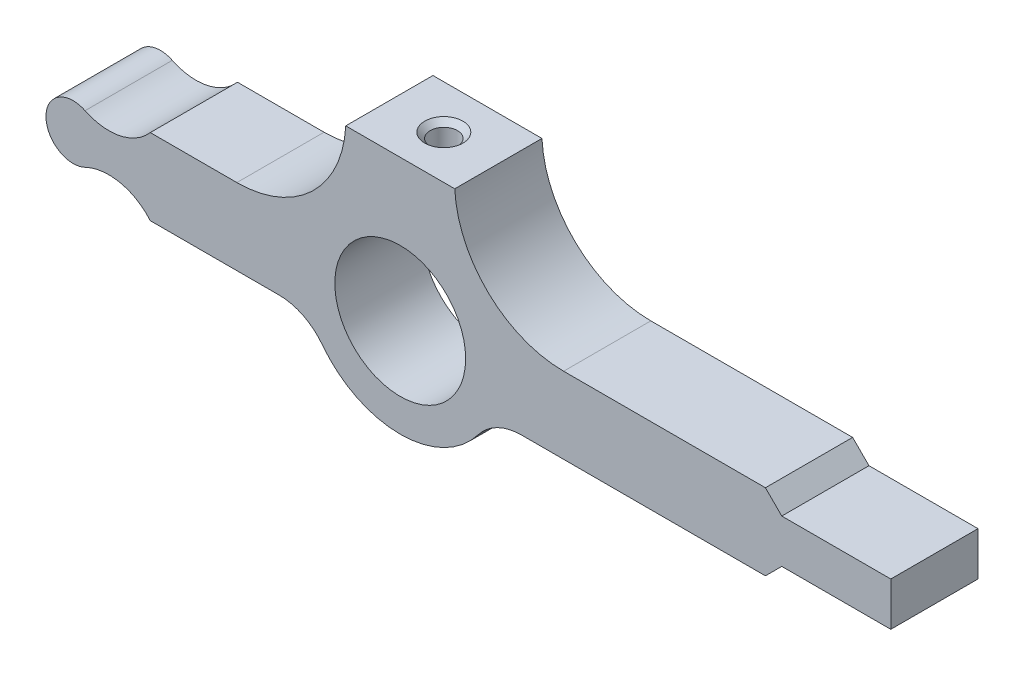
from build123d import *

# Parameters (mm, degrees)
SKETCH_1_R      = 6
EXTRUDE_1_DEPTH = 4


# Read off the part's stored shape, not the designer's step: Отверстие обработанное метчиком M31
with BuildPart() as part:
    # Эскиз1 → Бобышка-Вытянуть1 (new, symmetric)
    with BuildSketch(Plane.XY):
        with BuildLine():
            Line((11.124297731, -3.5), (33.5, -3.5))
            Line((33.5, -3.5), (35, -2))
            Line((35, -2), (45, -2))
            Line((45, -2), (45, 2))
            Line((45, 2), (35, 2))
            Line((35, 2), (33.5, 3.5))
            Line((33.5, 3.5), (14.987492178, 3.5))
            ThreePointArc((14.987492178, 3.5), (8.095467802, 6.254311627), (5, 13))
            Line((5, 13), (-5, 13))
            ThreePointArc((-5, 13), (-8.095467802, 6.254311627), (-14.987492178, 3.5))
            Line((-14.987492178, 3.5), (-22.931154754, 3.5))
            ThreePointArc((-22.931154754, 3.5), (-25.707642289, 1.855810024), (-28.910275264, 2.25))
            ThreePointArc((-28.910275264, 2.25), (-32.5, 0), (-28.910275264, -2.25))
            ThreePointArc((-28.910275264, -2.25), (-25.707642289, -1.855810024), (-22.931154754, -3.5))
            Line((-22.931154754, -3.5), (-11.124297731, -3.5))
            ThreePointArc((-11.124297731, -3.5), (-8.90828458, -4.017892715), (-7.151334255, -5.464285714))
            ThreePointArc((-7.151334255, -5.464285714), (0, -9), (7.151334255, -5.464285714))
            ThreePointArc((7.151334255, -5.464285714), (8.90828458, -4.017892715), (11.124297731, -3.5))
        make_face()
        Circle(SKETCH_1_R, mode=Mode.SUBTRACT)
    extrude(amount=EXTRUDE_1_DEPTH, both=True)

    # Отверстие обработанное метчиком M31 outline → Отверстие обработанное метчиком M31 (revolve, cut)
    with BuildSketch(Plane.XY):
        Polygon((0, 5.868327481), (1.25, 5.868327481), (1.25, 12.5), (1.75, 13), (0, 13), align=None)
    revolve(axis=Axis((0, 0, 0), (0, 1, 0)), mode=Mode.SUBTRACT)


solid = part.part
